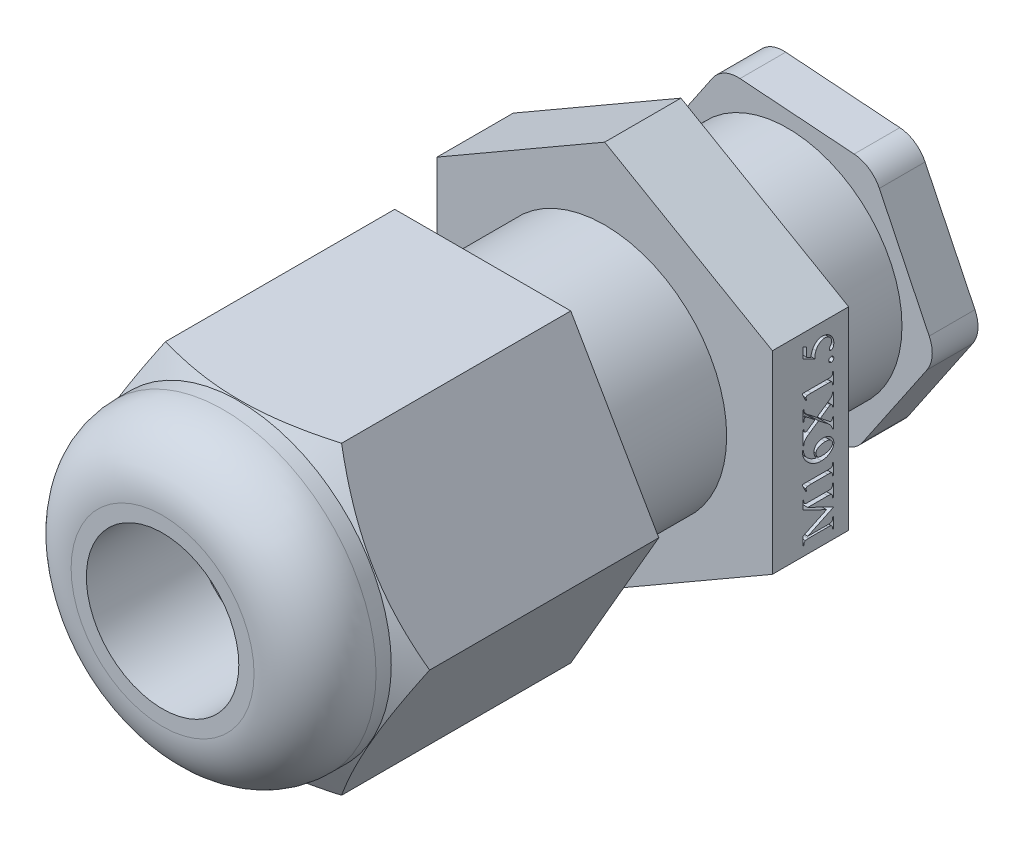
from build123d import *

# Parameters (mm, degrees)
SKETCH16_R          = 7.5
BOSS_EXTRUDE1_DEPTH = 5
BOSS_EXTRUDE2_DEPTH = 4
SKETCH18_R          = 9
BOSS_EXTRUDE3_DEPTH = 1
SKETCH19_R          = 7.5
BOSS_EXTRUDE4_DEPTH = 5
BOSS_EXTRUDE5_DEPTH = 5
SKETCH21_R          = 8
BOSS_EXTRUDE6_DEPTH = 8
BOSS_EXTRUDE7_DEPTH = 16
SKETCH24_R          = 10
BOSS_EXTRUDE8_DEPTH = 5
SKETCH25_R          = 5
CUT_EXTRUDE1_DEPTH  = 12
SKETCH26_R          = 6.75
CUT_EXTRUDE2_DEPTH  = 42
FILLET1_R           = 4
SKETCH29_R          = 19.264757238
SKETCH29_R_2        = 9.872983346
CUT_EXTRUDE6_DEPTH  = 11
CUT_EXTRUDE6_TAPER  = 60
SKETCH30_R          = 18.678262181
SKETCH30_R_2        = 11
CUT_EXTRUDE7_DEPTH  = 10.7366
CUT_EXTRUDE7_TAPER  = 60
CUT_EXTRUDE8_DEPTH  = 1
CUT_EXTRUDE9_DEPTH  = 1
SKETCH_2_OUTSIDE_W  = 39.556
SKETCH_2_OUTSIDE_H  = 39.556
CUT_EXTRUDE_2_DEPTH = 4
CUT_EXTRUDE_START   = -2
SKETCH_3_R          = 18.187553
SKETCH_3_R_2        = 7.5
CUT_EXTRUDE_5_DEPTH = 2
SKETCH_1_R          = 14.197721898
CUT_EXTRUDE_6_DEPTH = 5
FILLET_1_R          = 2


with BuildPart() as part:
    # Sketch16 → Boss-Extrude1 (new body)
    with BuildSketch(Plane.XY):
        Circle(SKETCH16_R)
    extrude(amount=BOSS_EXTRUDE1_DEPTH)

    # Sketch17 → Boss-Extrude2 (add)
    with BuildSketch(Plane.XY.offset(5)):
        Polygon((12.701705922, 0), (6.350852961, 11), (-6.350852961, 11), (-12.701705922, 0), (-6.350852961, -11), (6.350852961, -11), align=None)
    extrude(amount=BOSS_EXTRUDE2_DEPTH)

    # Sketch18 → Boss-Extrude3 (add)
    with BuildSketch(Plane.XY.offset(9)):
        Circle(SKETCH18_R)
    extrude(amount=BOSS_EXTRUDE3_DEPTH)

    # Sketch19 → Boss-Extrude4 (add)
    with BuildSketch(Plane.XY.offset(10)):
        Circle(SKETCH19_R)
    extrude(amount=BOSS_EXTRUDE4_DEPTH)

    # Sketch20 → Boss-Extrude5 (add)
    with BuildSketch(Plane.XY.offset(15)):
        Polygon((0, 12.701705922), (-11, 6.350852961), (-11, -6.350852961), (0, -12.701705922), (11, -6.350852961), (11, 6.350852961), align=None)
    extrude(amount=BOSS_EXTRUDE5_DEPTH)

    # Sketch21 → Boss-Extrude6 (add)
    with BuildSketch(Plane.XY.offset(20)):
        Circle(SKETCH21_R)
    extrude(amount=BOSS_EXTRUDE6_DEPTH)

    # Sketch22 → Boss-Extrude7 (add)
    with BuildSketch(Plane.XY.offset(28)):
        Polygon((-11.547005384, 0), (-5.773502692, -10), (5.773502692, -10), (11.547005384, 0), (5.773502692, 10), (-5.773502692, 10), align=None)
    extrude(amount=BOSS_EXTRUDE7_DEPTH)

    # Sketch24 → Boss-Extrude8 (add)
    with BuildSketch(Plane.XY.offset(44)):
        Circle(SKETCH24_R)
    extrude(amount=BOSS_EXTRUDE8_DEPTH)

    # Sketch25 → Cut-Extrude1 (cut)
    with BuildSketch(Plane.XY.offset(49)):
        Circle(SKETCH25_R)
    extrude(amount=-CUT_EXTRUDE1_DEPTH, mode=Mode.SUBTRACT)

    # Sketch26 → Cut-Extrude2 (cut)
    with BuildSketch(Plane(origin=(0, 0, 0), x_dir=(-1, 0, 0), z_dir=(0, 0, -1))):
        Circle(SKETCH26_R)
    extrude(amount=-CUT_EXTRUDE2_DEPTH, mode=Mode.SUBTRACT)

    # Fillet1
    fillet1_edges = [part.edges().sort_by_distance(p)[0] for p in [
        (-10, 0, 49),
    ]]
    fillet(fillet1_edges, radius=FILLET1_R)

    # Sketch29 → Cut-Extrude6 (cut)
    with BuildSketch(Plane.XY.offset(44)):
        Circle(SKETCH29_R)
        Circle(SKETCH29_R_2, mode=Mode.SUBTRACT)
    extrude(amount=-CUT_EXTRUDE6_DEPTH, taper=CUT_EXTRUDE6_TAPER, mode=Mode.SUBTRACT)

    # Sketch30 → Cut-Extrude7 (cut)
    with BuildSketch(Plane(origin=(0, 0, 5), x_dir=(-1, 0, 0), z_dir=(0, 0, -1))):
        Circle(SKETCH30_R)
        Circle(SKETCH30_R_2, mode=Mode.SUBTRACT)
    extrude(amount=-CUT_EXTRUDE7_DEPTH, taper=CUT_EXTRUDE7_TAPER, mode=Mode.SUBTRACT)

    # Sketch31 → Cut-Extrude8 (cut)
    # profile 1 of 7: a face of its own
    with BuildSketch(Plane(origin=(11, 0, 0), x_dir=(0, 0, -1), z_dir=(1, 0, 0))):
        with BuildLine():
            Line((-16, -4.541666667), (-17.682725694, -5.347222222))
            Line((-17.682725694, -5.347222222), (-16.361111111, -5.347222222))
            add(Edge.make_bspline(
                [(-16.361111111, -5.347222222), (-16.345770499, -5.34724275), (-16.316662808, -5.347281699), (-16.275288939, -5.344796252), (-16.238320865, -5.34210044), (-16.20592414, -5.337623373), (-16.177749353, -5.332872355), (-16.15448325, -5.325793584), (-16.135149531, -5.318436412), (-16.124901452, -5.311379491), (-16.120225694, -5.308159722)],
                knots=[0, 0, 0, 0, 1.48973486, 2.826663046, 4.025252461, 5.088590954, 6.003687083, 6.795186099, 7.45029523, 8, 8, 8, 8], degree=3))
            add(Edge.make_bspline(
                [(-16.120225694, -5.308159722), (-16.110237738, -5.298343436), (-16.08989818, -5.278353471), (-16.069447736, -5.238216396), (-16.057340454, -5.190968976), (-16.056173249, -5.156912059), (-16.055555556, -5.138888889)],
                knots=[0, 0, 0, 0, 0.893460505, 1.819450328, 2.846037184, 4, 4, 4, 4], degree=3))
            Line((-16.055555556, -5.138888889), (-16.055555556, -5.069444444))
            Line((-16.055555556, -5.069444444), (-16, -5.069444444))
            Line((-16, -5.069444444), (-16, -5.763888889))
            Line((-16, -5.763888889), (-16.055555556, -5.763888889))
            Line((-16.055555556, -5.763888889), (-16.055555556, -5.694444444))
            add(Edge.make_bspline(
                [(-16.055555556, -5.694444444), (-16.055773842, -5.684444844), (-16.056196396, -5.665087834), (-16.060335918, -5.637228468), (-16.066081948, -5.611490136), (-16.07502292, -5.588070034), (-16.086129786, -5.566745894), (-16.100157535, -5.54781163), (-16.116990298, -5.531599488), (-16.129518506, -5.52242981), (-16.135850694, -5.517795139)],
                knots=[0, 0, 0, 0, 1.182386838, 2.288838982, 3.326958154, 4.296765023, 5.246416275, 6.164047556, 7.072046332, 8, 8, 8, 8], degree=3))
            add(Edge.make_bspline(
                [(-16.135850694, -5.517795139), (-16.140565512, -5.515208074), (-16.150944778, -5.509512873), (-16.169397862, -5.503210213), (-16.191871892, -5.498295265), (-16.218030848, -5.493424553), (-16.248338101, -5.490012978), (-16.282396489, -5.488237389), (-16.320433771, -5.486143244), (-16.347073827, -5.4861222), (-16.361111111, -5.486111111)],
                knots=[0, 0, 0, 0, 0.561580455, 1.236271222, 2.028879402, 2.966584022, 4.017422664, 5.2149421, 6.532486222, 8, 8, 8, 8], degree=3))
            Line((-16.361111111, -5.486111111), (-17.638888889, -5.486111111))
            add(Edge.make_bspline(
                [(-17.638888889, -5.486111111), (-17.660469624, -5.486316999), (-17.700390107, -5.486697856), (-17.755471718, -5.492540065), (-17.801415826, -5.500474522), (-17.827650995, -5.510636379), (-17.839409722, -5.515190972)],
                knots=[0, 0, 0, 0, 1.269138846, 2.34767893, 3.259421848, 4, 4, 4, 4], degree=3))
            add(Edge.make_bspline(
                [(-17.839409722, -5.515190972), (-17.846655187, -5.518997182), (-17.861560789, -5.526827437), (-17.881422281, -5.543640307), (-17.899526017, -5.564569511), (-17.915992077, -5.590129375), (-17.929168816, -5.622527858), (-17.938310784, -5.662469948), (-17.943742284, -5.710499249), (-17.944198782, -5.745209655), (-17.944444444, -5.763888889)],
                knots=[0, 0, 0, 0, 0.685402419, 1.410031758, 2.167502244, 3.003026701, 3.950322296, 5.087339078, 6.432565839, 8, 8, 8, 8], degree=3))
            Line((-17.944444444, -5.763888889), (-18, -5.763888889))
            Line((-18, -5.763888889), (-18, -5.194010417))
            Line((-18, -5.194010417), (-16.445746528, -4.450954861))
            Line((-16.445746528, -4.450954861), (-18, -3.705729167))
            Line((-18, -3.705729167), (-18, -3.152777778))
            Line((-18, -3.152777778), (-17.944444444, -3.152777778))
            Line((-17.944444444, -3.152777778), (-17.944444444, -3.220920139))
            add(Edge.make_bspline(
                [(-17.944444444, -3.220920139), (-17.944236475, -3.231065833), (-17.943836667, -3.250570269), (-17.939601147, -3.278699435), (-17.933997309, -3.304618532), (-17.924963948, -3.328154692), (-17.91389469, -3.349510102), (-17.899699402, -3.368420291), (-17.883163992, -3.38507985), (-17.870505641, -3.394261169), (-17.864149306, -3.398871528)],
                knots=[0, 0, 0, 0, 1.192663738, 2.292818382, 3.341598875, 4.305885976, 5.250132179, 6.162540657, 7.077327887, 8, 8, 8, 8], degree=3))
            add(Edge.make_bspline(
                [(-17.864149306, -3.398871528), (-17.859434488, -3.401458593), (-17.849055222, -3.407153794), (-17.830602138, -3.413456454), (-17.808128108, -3.418371402), (-17.781969152, -3.423242114), (-17.751661899, -3.426653689), (-17.717603511, -3.428429278), (-17.679566229, -3.430523423), (-17.652926173, -3.430544467), (-17.638888889, -3.430555556)],
                knots=[0, 0, 0, 0, 0.561580455, 1.236271222, 2.028879402, 2.966584022, 4.017422664, 5.2149421, 6.532486222, 8, 8, 8, 8], degree=3))
            Line((-17.638888889, -3.430555556), (-16.361111111, -3.430555556))
            add(Edge.make_bspline(
                [(-16.361111111, -3.430555556), (-16.345770926, -3.430574035), (-16.316664045, -3.430609099), (-16.275284764, -3.428149617), (-16.238334116, -3.425370198), (-16.205855699, -3.421149479), (-16.177817424, -3.415606733), (-16.154375426, -3.408831289), (-16.1351064, -3.400891646), (-16.124897362, -3.393550355), (-16.120225694, -3.390190972)],
                knots=[0, 0, 0, 0, 1.486776415, 2.821049613, 4.017258766, 5.078485589, 5.994452933, 6.784380121, 7.443731031, 8, 8, 8, 8], degree=3))
            add(Edge.make_bspline(
                [(-16.120225694, -3.390190972), (-16.110219938, -3.38038311), (-16.08975233, -3.360320312), (-16.069649851, -3.32001649), (-16.057259884, -3.272885286), (-16.056146959, -3.238952075), (-16.055555556, -3.220920139)],
                knots=[0, 0, 0, 0, 0.893634595, 1.828003868, 2.845812335, 4, 4, 4, 4], degree=3))
            Line((-16.055555556, -3.220920139), (-16.055555556, -3.152777778))
            Line((-16.055555556, -3.152777778), (-16, -3.152777778))
            Line((-16, -3.152777778), (-16, -3.986111111))
            Line((-16, -3.986111111), (-16.055555556, -3.986111111))
            Line((-16.055555556, -3.986111111), (-16.055555556, -3.916666667))
            add(Edge.make_bspline(
                [(-16.055555556, -3.916666667), (-16.0557699, -3.906522909), (-16.056181965, -3.887022195), (-16.060311747, -3.859006777), (-16.066194348, -3.833179556), (-16.074797067, -3.809609778), (-16.086272013, -3.78846108), (-16.100154537, -3.769610817), (-16.116874922, -3.753375639), (-16.129503227, -3.744485755), (-16.135850694, -3.740017361)],
                knots=[0, 0, 0, 0, 1.198333024, 2.303717216, 3.340834392, 4.325725627, 5.259386468, 6.176132048, 7.08325442, 8, 8, 8, 8], degree=3))
            add(Edge.make_bspline(
                [(-16.135850694, -3.740017361), (-16.140565512, -3.737430296), (-16.150944778, -3.731735095), (-16.169397862, -3.725432435), (-16.191871892, -3.720517487), (-16.218030848, -3.715646775), (-16.248338101, -3.7122352), (-16.282396489, -3.710459611), (-16.320433771, -3.708365466), (-16.347073827, -3.708344422), (-16.361111111, -3.708333333)],
                knots=[0, 0, 0, 0, 0.561580455, 1.236271222, 2.028879402, 2.966584022, 4.017422664, 5.2149421, 6.532486222, 8, 8, 8, 8], degree=3))
            Line((-16.361111111, -3.708333333), (-17.682725694, -3.708333333))
            Line((-17.682725694, -3.708333333), (-16, -4.513888889))
            Line((-16, -4.513888889), (-16, -4.541666667))
        make_face()
    # profile 2 of 7: a face of its own
    with BuildSketch(Plane(origin=(11, 0, 0), x_dir=(0, 0, -1), z_dir=(1, 0, 0))):
        with BuildLine():
            Line((-17.805555556, -2.763888889), (-18.027777778, -2.286024306))
            Line((-18.027777778, -2.286024306), (-18.027777778, -2.236111111))
            Line((-18.027777778, -2.236111111), (-16.361111111, -2.236111111))
            add(Edge.make_bspline(
                [(-16.361111111, -2.236111111), (-16.347367835, -2.235938757), (-16.321327775, -2.235612188), (-16.284270781, -2.235571698), (-16.251452241, -2.23387912), (-16.222606371, -2.233061172), (-16.197920299, -2.230487156), (-16.177104857, -2.228863409), (-16.160531866, -2.225560346), (-16.143725181, -2.221927461), (-16.126407109, -2.214104623), (-16.108214002, -2.201589273), (-16.093474614, -2.18436609), (-16.079752236, -2.163169064), (-16.069453964, -2.133767905), (-16.062202686, -2.094479035), (-16.057289884, -2.044091644), (-16.05617045, -2.00666773), (-16.055555556, -1.986111111)],
                knots=[0, 0, 0, 0, 1.357537047, 2.572192221, 3.65900743, 4.603059937, 5.420664606, 6.110251137, 6.662371709, 7.088655706, 7.805391913, 8.522982225, 9.251584797, 10.028600307, 11.005287387, 12.302763454, 13.969141288, 16, 16, 16, 16], degree=3))
            Line((-16.055555556, -1.986111111), (-16, -1.986111111))
            Line((-16, -1.986111111), (-16, -2.736111111))
            Line((-16, -2.736111111), (-16.055555556, -2.736111111))
            add(Edge.make_bspline(
                [(-16.055555556, -2.736111111), (-16.05613842, -2.71511397), (-16.057193658, -2.677099992), (-16.062369785, -2.62637071), (-16.068746243, -2.587504624), (-16.079059079, -2.559495004), (-16.091786803, -2.539478669), (-16.105599364, -2.523623139), (-16.12180143, -2.51123386), (-16.137153717, -2.502739793), (-16.152676082, -2.497548721), (-16.169095794, -2.494992891), (-16.189719584, -2.491693297), (-16.215117285, -2.489846854), (-16.245062851, -2.488105793), (-16.279647056, -2.486722315), (-16.318866657, -2.486587902), (-16.346499217, -2.486276028), (-16.361111111, -2.486111111)],
                knots=[0, 0, 0, 0, 2.071866718, 3.750981977, 5.030543592, 5.947914073, 6.672790165, 7.360438368, 8.011547801, 8.675827944, 9.08214479, 9.619746245, 10.312267781, 11.143377009, 12.130110662, 13.273034934, 14.558000933, 16, 16, 16, 16], degree=3))
            Line((-16.361111111, -2.486111111), (-17.444444444, -2.486111111))
            add(Edge.make_bspline(
                [(-17.444444444, -2.486111111), (-17.460649391, -2.486014188), (-17.491615251, -2.485828978), (-17.53587599, -2.487082399), (-17.575690623, -2.487469683), (-17.610817141, -2.489612993), (-17.641409823, -2.490861849), (-17.66724918, -2.493829345), (-17.688806335, -2.495908033), (-17.701406234, -2.498737038), (-17.70703125, -2.5)],
                knots=[0, 0, 0, 0, 1.476765178, 2.821934835, 4.035278551, 5.104597693, 6.029081604, 6.824151588, 7.47506195, 8, 8, 8, 8], degree=3))
            add(Edge.make_bspline(
                [(-17.70703125, -2.5), (-17.714034764, -2.501841571), (-17.727310236, -2.50533235), (-17.745533876, -2.513223798), (-17.761036495, -2.523287736), (-17.777569957, -2.539247759), (-17.792525305, -2.564415602), (-17.794544394, -2.587013137), (-17.795572917, -2.598524306)],
                knots=[0, 0, 0, 0, 0.903062441, 1.711795068, 2.468214314, 3.196286531, 4.571790261, 6, 6, 6, 6], degree=3))
            add(Edge.make_bspline(
                [(-17.795572917, -2.598524306), (-17.794801971, -2.607964456), (-17.793084312, -2.628997), (-17.784300237, -2.662845199), (-17.769598653, -2.701592158), (-17.756863996, -2.728533915), (-17.75, -2.743055556)],
                knots=[0, 0, 0, 0, 0.743837888, 1.657262055, 2.737261251, 4, 4, 4, 4], degree=3))
            Line((-17.75, -2.743055556), (-17.805555556, -2.763888889))
        make_face()
    # profile 3 of 7: a face of its own
    with BuildSketch(Plane(origin=(11, 0, 0), x_dir=(0, 0, -1), z_dir=(1, 0, 0))):
        with BuildLine():
            Line((-18.027777778, -0.319444444), (-17.972222222, -0.319444444))
            add(Edge.make_bspline(
                [(-17.972222222, -0.319444444), (-17.968745061, -0.349454345), (-17.962073094, -0.407037245), (-17.945703481, -0.488657648), (-17.924527463, -0.561766925), (-17.898273363, -0.627795747), (-17.864358828, -0.688471903), (-17.824641221, -0.747994059), (-17.777063112, -0.806877683), (-17.722953993, -0.864734974), (-17.66351763, -0.920083707), (-17.599624918, -0.970521884), (-17.533053072, -1.01715125), (-17.462057465, -1.058078985), (-17.385981697, -1.094884046), (-17.303827392, -1.128059868), (-17.215058719, -1.158669764), (-17.153027877, -1.175696344), (-17.12109375, -1.184461806)],
                knots=[0, 0, 0, 0, 1.11204756, 2.133793223, 3.060920484, 3.911654629, 4.743669759, 5.61537704, 6.54383481, 7.52755882, 8.530240389, 9.531080642, 10.522620089, 11.520364966, 12.544842705, 13.632012097, 14.780935022, 16, 16, 16, 16], degree=3))
            add(Edge.make_bspline(
                [(-17.12109375, -1.184461806), (-17.133657591, -1.167135303), (-17.158228218, -1.13325052), (-17.189857115, -1.080410783), (-17.216932756, -1.027825202), (-17.239298545, -0.975258099), (-17.256336229, -0.922353538), (-17.268404041, -0.869487829), (-17.276198319, -0.816490999), (-17.27725135, -0.781131599), (-17.277777778, -0.763454861)],
                knots=[0, 0, 0, 0, 1.123331773, 2.196857368, 3.229697486, 4.227207333, 5.192971132, 6.143860852, 7.072085882, 8, 8, 8, 8], degree=3))
            add(Edge.make_bspline(
                [(-17.277777778, -0.763454861), (-17.277301388, -0.746784227), (-17.276363889, -0.713977636), (-17.26818483, -0.665653594), (-17.255223069, -0.619046415), (-17.236858119, -0.574043934), (-17.21317211, -0.530978523), (-17.184697673, -0.489272536), (-17.150806434, -0.449419691), (-17.111819285, -0.411988664), (-17.069139351, -0.377340267), (-17.022999236, -0.346804428), (-16.973693142, -0.321050656), (-16.921369102, -0.300383808), (-16.86640969, -0.283649305), (-16.808412699, -0.272090437), (-16.747430906, -0.264966945), (-16.705749344, -0.26425334), (-16.684461806, -0.263888889)],
                knots=[0, 0, 0, 0, 0.926349197, 1.822987553, 2.716915442, 3.611711575, 4.518861204, 5.444826117, 6.415086364, 7.422034801, 8.445934706, 9.467778553, 10.493225684, 11.532898844, 12.591568671, 13.683280022, 14.8168086, 16, 16, 16, 16], degree=3))
            add(Edge.make_bspline(
                [(-16.684461806, -0.263888889), (-16.663603955, -0.264217548), (-16.622330987, -0.264867889), (-16.561273609, -0.272744174), (-16.501546206, -0.284506443), (-16.442964267, -0.300167849), (-16.386085284, -0.321924805), (-16.330629395, -0.348059083), (-16.276044854, -0.378175069), (-16.241702729, -0.402035498), (-16.224392361, -0.4140625)],
                knots=[0, 0, 0, 0, 1.016578158, 2.011578234, 2.996749356, 3.984342785, 4.964524385, 5.961897944, 6.972681627, 8, 8, 8, 8], degree=3))
            add(Edge.make_bspline(
                [(-16.224392361, -0.4140625), (-16.204335181, -0.429236569), (-16.165086408, -0.458929854), (-16.113792583, -0.510230188), (-16.069806368, -0.564760292), (-16.033889684, -0.623191634), (-16.006531354, -0.685530172), (-15.986226144, -0.751114206), (-15.974403011, -0.82060857), (-15.9729579, -0.868155765), (-15.972222222, -0.892361111)],
                knots=[0, 0, 0, 0, 1.070547348, 2.094894131, 3.081678243, 4.0500961, 5.007721965, 5.97488336, 6.96905275, 8, 8, 8, 8], degree=3))
            add(Edge.make_bspline(
                [(-15.972222222, -0.892361111), (-15.97265986, -0.909016995), (-15.973519087, -0.941717951), (-15.979684891, -0.989834159), (-15.990021975, -1.035943976), (-16.004890429, -1.080154021), (-16.024183701, -1.122332841), (-16.047137071, -1.16290492), (-16.074548385, -1.201279484), (-16.095687339, -1.224730762), (-16.106336806, -1.236545139)],
                knots=[0, 0, 0, 0, 1.054945317, 2.071203223, 3.06725916, 4.043942597, 5.020109906, 6.001126647, 6.992999677, 8, 8, 8, 8], degree=3))
            add(Edge.make_bspline(
                [(-16.106336806, -1.236545139), (-16.128429237, -1.258773211), (-16.172206569, -1.30281932), (-16.245644822, -1.359079469), (-16.323619452, -1.40693814), (-16.406300359, -1.44601254), (-16.493846394, -1.476693955), (-16.586252128, -1.498159932), (-16.683491559, -1.511533812), (-16.749955892, -1.513093443), (-16.783854167, -1.513888889)],
                knots=[0, 0, 0, 0, 0.996887487, 1.97538571, 2.93683217, 3.905260266, 4.881326787, 5.88466394, 6.921131994, 8, 8, 8, 8], degree=3))
            add(Edge.make_bspline(
                [(-16.783854167, -1.513888889), (-16.805853095, -1.513522413), (-16.849612253, -1.512793437), (-16.914957802, -1.507932181), (-16.979455286, -1.499817457), (-17.0431302, -1.48785252), (-17.105883847, -1.473239756), (-17.167910342, -1.455341086), (-17.229077227, -1.434111473), (-17.289298362, -1.409356759), (-17.348183874, -1.381558883), (-17.405702281, -1.351268455), (-17.461234755, -1.317562229), (-17.5154759, -1.281819013), (-17.567779568, -1.242815088), (-17.618620165, -1.201421775), (-17.66712598, -1.156310265), (-17.714141237, -1.10963281), (-17.757920259, -1.061200651), (-17.798694782, -1.013221449), (-17.835825865, -0.96587042), (-17.868823769, -0.918822921), (-17.898503309, -0.872490472), (-17.924181916, -0.82641134), (-17.945980201, -0.780904238), (-17.969229912, -0.721710451), (-17.992448057, -0.649530774), (-18.012443268, -0.56461954), (-18.025486076, -0.482753878), (-18.027026113, -0.42900947), (-18.027777778, -0.402777778)],
                knots=[0, 0, 0, 0, 1.006519091, 2.00211706, 2.996415824, 3.979256571, 4.965124328, 5.943496579, 6.931606334, 7.926081361, 8.921040949, 9.910081525, 10.898878399, 11.892118928, 12.881093046, 13.88292124, 14.890158396, 15.910556394, 16.913324523, 17.876166787, 18.79114971, 19.665330668, 20.504552116, 21.307593167, 22.077426548, 22.811271048, 24.215940873, 25.542181098, 26.800382202, 28, 28, 28, 28], degree=3))
            Line((-18.027777778, -0.402777778), (-18.027777778, -0.319444444))
        make_face()
        with BuildLine():
            add(Edge.make_bspline(
                [(-17.013888889, -1.208333333), (-16.982370042, -1.21255698), (-16.922740749, -1.220547535), (-16.837787399, -1.229257253), (-16.76251841, -1.234894059), (-16.715430485, -1.235725315), (-16.693576389, -1.236111111)],
                knots=[0, 0, 0, 0, 1.186006894, 2.243760764, 3.18490739, 4, 4, 4, 4], degree=3))
            add(Edge.make_bspline(
                [(-16.693576389, -1.236111111), (-16.66952927, -1.23553416), (-16.620241603, -1.234351624), (-16.544985604, -1.224079082), (-16.466653833, -1.208493511), (-16.387084981, -1.186760108), (-16.309728205, -1.159733161), (-16.23919119, -1.125384622), (-16.177068636, -1.084663663), (-16.141812272, -1.052001569), (-16.124565972, -1.036024306)],
                knots=[0, 0, 0, 0, 0.935169282, 1.916749931, 2.94995263, 4.040933046, 5.12340098, 6.132811626, 7.086630455, 8, 8, 8, 8], degree=3))
            add(Edge.make_bspline(
                [(-16.124565972, -1.036024306), (-16.113835281, -1.023707605), (-16.092733835, -0.999487337), (-16.071606459, -0.955991233), (-16.05781546, -0.909268041), (-16.056320499, -0.876550152), (-16.055555556, -0.859809028)],
                knots=[0, 0, 0, 0, 1.006861896, 1.979951003, 2.966379127, 4, 4, 4, 4], degree=3))
            add(Edge.make_bspline(
                [(-16.055555556, -0.859809028), (-16.055867734, -0.849659172), (-16.056492535, -0.829345019), (-16.062217818, -0.799364936), (-16.072170487, -0.77040995), (-16.084844011, -0.741886327), (-16.102931935, -0.715176572), (-16.12312591, -0.688167184), (-16.148199738, -0.662884135), (-16.176272052, -0.638116658), (-16.207630235, -0.615032404), (-16.242954144, -0.595569584), (-16.281018936, -0.578461517), (-16.3227707, -0.565290865), (-16.367356352, -0.554193309), (-16.415490134, -0.547267104), (-16.466612144, -0.542102751), (-16.501866094, -0.541814601), (-16.519965278, -0.541666667)],
                knots=[0, 0, 0, 0, 0.779158178, 1.559425028, 2.332536961, 3.128085406, 3.94801914, 4.803769406, 5.7154175, 6.676136198, 7.678622712, 8.698633232, 9.768284987, 10.878777097, 12.056618743, 13.293527951, 14.610512161, 16, 16, 16, 16], degree=3))
            add(Edge.make_bspline(
                [(-16.519965278, -0.541666667), (-16.540520347, -0.541831714), (-16.581110359, -0.542157631), (-16.640770158, -0.547277967), (-16.698451294, -0.554522647), (-16.754056182, -0.564739338), (-16.807421341, -0.578864034), (-16.858939127, -0.595301663), (-16.908330392, -0.614692462), (-16.954901827, -0.637147835), (-16.998009544, -0.661753686), (-17.035371913, -0.690168745), (-17.067491535, -0.720459771), (-17.093621648, -0.753678649), (-17.114176564, -0.789266139), (-17.1287529, -0.8276374), (-17.137012932, -0.868571731), (-17.13825435, -0.896664806), (-17.138888889, -0.911024306)],
                knots=[0, 0, 0, 0, 1.236325581, 2.441367134, 3.599860823, 4.733462644, 5.839765943, 6.918852512, 7.985686968, 9.029074807, 10.027827683, 10.966187413, 11.846555316, 12.677192625, 13.499901681, 14.309848309, 15.13609552, 16, 16, 16, 16], degree=3))
            add(Edge.make_bspline(
                [(-17.138888889, -0.911024306), (-17.137500925, -0.929641298), (-17.134564207, -0.969032006), (-17.119418794, -1.019173564), (-17.099214086, -1.063983293), (-17.076916913, -1.105720818), (-17.048111179, -1.154947401), (-17.025890773, -1.189610688), (-17.013888889, -1.208333333)],
                knots=[0, 0, 0, 0, 1.025998358, 2.17085558, 2.859346783, 3.732571271, 4.775296047, 6, 6, 6, 6], degree=3))
        make_face(mode=Mode.SUBTRACT)
    # profile 4 of 7: a face of its own
    with BuildSketch(Plane(origin=(11, 0, 0), x_dir=(0, 0, -1), z_dir=(1, 0, 0))):
        with BuildLine():
            Line((-17.084635417, 1.111545139), (-16.464409722, 1.541666667))
            add(Edge.make_bspline(
                [(-16.464409722, 1.541666667), (-16.443369718, 1.555900414), (-16.40324454, 1.583045449), (-16.346757654, 1.62330771), (-16.295858347, 1.659808134), (-16.251406046, 1.694288324), (-16.213069349, 1.725875995), (-16.180094854, 1.753797039), (-16.153868464, 1.779627076), (-16.126465983, 1.810009128), (-16.099915643, 1.849840187), (-16.076974469, 1.902330807), (-16.060788936, 1.960198004), (-16.057337329, 2.001048003), (-16.055555556, 2.022135417)],
                knots=[0, 0, 0, 0, 1.387499065, 2.64608532, 3.78894435, 4.808511917, 5.718178103, 6.502496184, 7.167495823, 7.727304262, 8.735538158, 9.765011329, 10.846263605, 12, 12, 12, 12], degree=3))
            Line((-16.055555556, 2.022135417), (-16, 2.022135417))
            Line((-16, 2.022135417), (-16, 1.170572917))
            Line((-16, 1.170572917), (-16.055555556, 1.170572917))
            add(Edge.make_bspline(
                [(-16.055555556, 1.170572917), (-16.055982993, 1.183892516), (-16.056778999, 1.20869724), (-16.060078368, 1.243095374), (-16.065311622, 1.272000034), (-16.071143943, 1.288823558), (-16.073784722, 1.296440972)],
                knots=[0, 0, 0, 0, 1.251101252, 2.329891665, 3.243802496, 4, 4, 4, 4], degree=3))
            add(Edge.make_bspline(
                [(-16.073784722, 1.296440972), (-16.078833933, 1.306319873), (-16.088977845, 1.326166674), (-16.114602901, 1.347014241), (-16.141679442, 1.363978837), (-16.162103583, 1.365855588), (-16.171875, 1.366753472)],
                knots=[0, 0, 0, 0, 1.037879564, 2.085109583, 3.083868751, 4, 4, 4, 4], degree=3))
            add(Edge.make_bspline(
                [(-16.171875, 1.366753472), (-16.183546136, 1.366101273), (-16.20730091, 1.364773824), (-16.229849414, 1.357167709), (-16.241319444, 1.353298611)],
                knots=[0, 0, 0, 0, 0.98263495, 2, 2, 2, 2], degree=3))
            add(Edge.make_bspline(
                [(-16.241319444, 1.353298611), (-16.247446187, 1.35050122), (-16.263489336, 1.343176126), (-16.291281753, 1.325948713), (-16.329624183, 1.302118163), (-16.358396344, 1.283478661), (-16.374565972, 1.273003472)],
                knots=[0, 0, 0, 0, 0.51870283, 1.358246357, 2.515364433, 4, 4, 4, 4], degree=3))
            Line((-16.374565972, 1.273003472), (-16.858940972, 0.937065972))
            Line((-16.858940972, 0.937065972), (-16.324652778, 0.5234375))
            add(Edge.make_bspline(
                [(-16.324652778, 0.5234375), (-16.312552032, 0.513533798), (-16.290552475, 0.495528541), (-16.2605638, 0.472415306), (-16.237405589, 0.455314472), (-16.215504495, 0.441885932), (-16.190776405, 0.433226561), (-16.171508432, 0.431734318), (-16.161892361, 0.430989583)],
                knots=[0, 0, 0, 0, 1.473107506, 2.678158142, 3.56707412, 4.184223009, 5.093799796, 6, 6, 6, 6], degree=3))
            add(Edge.make_bspline(
                [(-16.161892361, 0.430989583), (-16.154728485, 0.431480889), (-16.140719423, 0.432441644), (-16.120916174, 0.440396506), (-16.103080885, 0.452846391), (-16.0873151, 0.471189961), (-16.074013759, 0.496662172), (-16.064619816, 0.530587697), (-16.058530073, 0.573162442), (-16.056606846, 0.604433903), (-16.055555556, 0.621527778)],
                knots=[0, 0, 0, 0, 0.706616658, 1.38179906, 2.080689712, 2.841480654, 3.75083194, 4.901116067, 6.306061405, 8, 8, 8, 8], degree=3))
            Line((-16.055555556, 0.621527778), (-16, 0.621527778))
            Line((-16, 0.621527778), (-16, -0.086371528))
            Line((-16, -0.086371528), (-16.055555556, -0.086371528))
            add(Edge.make_bspline(
                [(-16.055555556, -0.086371528), (-16.056994986, -0.074340026), (-16.059783102, -0.051035522), (-16.066355132, -0.017377502), (-16.074654488, 0.013845348), (-16.082558635, 0.033198788), (-16.086371528, 0.042534722)],
                knots=[0, 0, 0, 0, 1.092521585, 2.116167512, 3.09125531, 4, 4, 4, 4], degree=3))
            add(Edge.make_bspline(
                [(-16.086371528, 0.042534722), (-16.092958122, 0.057537768), (-16.106235315, 0.087780764), (-16.130215524, 0.131594778), (-16.157841591, 0.17410923), (-16.188639737, 0.216953465), (-16.226154622, 0.260140586), (-16.270998196, 0.305902596), (-16.325109915, 0.35374667), (-16.364604379, 0.385856795), (-16.385416667, 0.402777778)],
                knots=[0, 0, 0, 0, 0.829792481, 1.67268776, 2.526568635, 3.397362151, 4.343374619, 5.421396993, 6.641160757, 8, 8, 8, 8], degree=3))
            Line((-16.385416667, 0.402777778), (-16.973524306, 0.858072917))
            Line((-16.973524306, 0.858072917), (-17.555989583, 0.458333333))
            add(Edge.make_bspline(
                [(-17.555989583, 0.458333333), (-17.574871516, 0.445417514), (-17.611357245, 0.420460162), (-17.662817234, 0.382743262), (-17.709501139, 0.3468309), (-17.750842294, 0.311994276), (-17.787281678, 0.278778181), (-17.818632957, 0.247107573), (-17.845073844, 0.217203727), (-17.872748151, 0.178990168), (-17.900290612, 0.130063128), (-17.924450007, 0.067546014), (-17.939928433, 0.000716429), (-17.942921191, -0.045491507), (-17.944444444, -0.069010417)],
                knots=[0, 0, 0, 0, 1.201407909, 2.321491269, 3.35044647, 4.294144544, 5.159992148, 5.939075303, 6.63385896, 7.253953056, 8.414142417, 9.57121737, 10.763798548, 12, 12, 12, 12], degree=3))
            Line((-17.944444444, -0.069010417), (-18, -0.069010417))
            Line((-18, -0.069010417), (-18, 0.848524306))
            Line((-18, 0.848524306), (-17.944444444, 0.848524306))
            add(Edge.make_bspline(
                [(-17.944444444, 0.848524306), (-17.943396144, 0.830539241), (-17.941465251, 0.797412082), (-17.933223374, 0.752438031), (-17.922323479, 0.71587864), (-17.906027755, 0.688300329), (-17.886544189, 0.669476348), (-17.867196844, 0.655313727), (-17.846350258, 0.646407899), (-17.831820937, 0.645441874), (-17.824652778, 0.644965278)],
                knots=[0, 0, 0, 0, 1.65453305, 3.047527545, 4.195711958, 5.14457816, 5.953356552, 6.669203758, 7.343440861, 8, 8, 8, 8], degree=3))
            add(Edge.make_bspline(
                [(-17.824652778, 0.644965278), (-17.813846648, 0.645963346), (-17.789402095, 0.648221077), (-17.750722729, 0.6636635), (-17.704973596, 0.684973108), (-17.673691842, 0.70460433), (-17.656684028, 0.715277778)],
                knots=[0, 0, 0, 0, 0.704815569, 1.594363781, 2.692061453, 4, 4, 4, 4], degree=3))
            Line((-17.656684028, 0.715277778), (-17.198784722, 1.032552083))
            Line((-17.198784722, 1.032552083), (-17.650173611, 1.381944444))
            add(Edge.make_bspline(
                [(-17.650173611, 1.381944444), (-17.66286544, 1.39125762), (-17.686039976, 1.408262931), (-17.717709739, 1.430386396), (-17.743118095, 1.446239084), (-17.767522216, 1.459807219), (-17.794995472, 1.469233076), (-17.816621758, 1.470654937), (-17.827256944, 1.471354167)],
                knots=[0, 0, 0, 0, 1.403888287, 2.563417624, 3.444161552, 4.073323755, 5.052515946, 6, 6, 6, 6], degree=3))
            add(Edge.make_bspline(
                [(-17.827256944, 1.471354167), (-17.837616918, 1.470669563), (-17.858068165, 1.469318111), (-17.87579945, 1.459056466), (-17.884548611, 1.453993056)],
                knots=[0, 0, 0, 0, 1.013138557, 2, 2, 2, 2], degree=3))
            add(Edge.make_bspline(
                [(-17.884548611, 1.453993056), (-17.894227442, 1.446143921), (-17.913173105, 1.430779764), (-17.929401302, 1.402653531), (-17.936296968, 1.374106106), (-17.940345628, 1.343719858), (-17.943176044, 1.304443731), (-17.943994929, 1.275179017), (-17.944444444, 1.259114583)],
                knots=[0, 0, 0, 0, 1.047759031, 2.050918148, 2.671197225, 3.524264695, 4.64098155, 6, 6, 6, 6], degree=3))
            Line((-17.944444444, 1.259114583), (-18, 1.259114583))
            Line((-18, 1.259114583), (-18, 1.981336806))
            Line((-18, 1.981336806), (-17.944444444, 1.981336806))
            add(Edge.make_bspline(
                [(-17.944444444, 1.981336806), (-17.943501359, 1.968000847), (-17.9417104, 1.942675286), (-17.935793171, 1.906612813), (-17.92868278, 1.874083359), (-17.920821062, 1.854377435), (-17.917100694, 1.845052083)],
                knots=[0, 0, 0, 0, 1.147917493, 2.179944869, 3.138703006, 4, 4, 4, 4], degree=3))
            add(Edge.make_bspline(
                [(-17.917100694, 1.845052083), (-17.910920059, 1.832081649), (-17.89860031, 1.80622792), (-17.876701769, 1.76894672), (-17.851409109, 1.733653495), (-17.828145751, 1.704668369), (-17.806178581, 1.681959657), (-17.787020606, 1.662619822), (-17.76451793, 1.641807641), (-17.738196433, 1.62003612), (-17.709866988, 1.595466895), (-17.677753947, 1.569906403), (-17.642949896, 1.542149183), (-17.61824628, 1.52352298), (-17.60546875, 1.513888889)],
                knots=[0, 0, 0, 0, 1.123530187, 2.239512141, 3.376131121, 4.517921176, 5.142280629, 5.846454719, 6.647292451, 7.5384269, 8.517942262, 9.580127646, 10.748361669, 12, 12, 12, 12], degree=3))
            Line((-17.60546875, 1.513888889), (-17.084635417, 1.111545139))
        make_face()
    # profile 5 of 7: a face of its own
    with BuildSketch(Plane(origin=(11, 0, 0), x_dir=(0, 0, -1), z_dir=(1, 0, 0))):
        with BuildLine():
            Line((-17.805555556, 2.402777778), (-18.027777778, 2.880642361))
            Line((-18.027777778, 2.880642361), (-18.027777778, 2.930555556))
            Line((-18.027777778, 2.930555556), (-16.361111111, 2.930555556))
            add(Edge.make_bspline(
                [(-16.361111111, 2.930555556), (-16.347367835, 2.93072791), (-16.321327775, 2.931054479), (-16.284270781, 2.931094969), (-16.251452241, 2.932787547), (-16.222606371, 2.933605495), (-16.197920299, 2.936179511), (-16.177104857, 2.937803258), (-16.160531866, 2.941106321), (-16.143725181, 2.944739206), (-16.126407109, 2.952562044), (-16.108214002, 2.965077394), (-16.093474614, 2.982300576), (-16.079752236, 3.003497603), (-16.069453964, 3.032898762), (-16.062202686, 3.072187632), (-16.057289884, 3.122575023), (-16.05617045, 3.159998937), (-16.055555556, 3.180555556)],
                knots=[0, 0, 0, 0, 1.357537047, 2.572192221, 3.65900743, 4.603059937, 5.420664606, 6.110251137, 6.662371709, 7.088655706, 7.805391913, 8.522982225, 9.251584797, 10.028600307, 11.005287387, 12.302763454, 13.969141288, 16, 16, 16, 16], degree=3))
            Line((-16.055555556, 3.180555556), (-16, 3.180555556))
            Line((-16, 3.180555556), (-16, 2.430555556))
            Line((-16, 2.430555556), (-16.055555556, 2.430555556))
            add(Edge.make_bspline(
                [(-16.055555556, 2.430555556), (-16.05613842, 2.451552696), (-16.057193658, 2.489566675), (-16.062369785, 2.540295957), (-16.068746243, 2.579162043), (-16.079059079, 2.607171662), (-16.091786803, 2.627187997), (-16.105599364, 2.643043528), (-16.12180143, 2.655432806), (-16.137153717, 2.663926874), (-16.152676082, 2.669117946), (-16.169095794, 2.671673775), (-16.189719584, 2.67497337), (-16.215117285, 2.676819812), (-16.245062851, 2.678560874), (-16.279647056, 2.679944352), (-16.318866657, 2.680078765), (-16.346499217, 2.680390639), (-16.361111111, 2.680555556)],
                knots=[0, 0, 0, 0, 2.071866718, 3.750981977, 5.030543592, 5.947914073, 6.672790165, 7.360438368, 8.011547801, 8.675827944, 9.08214479, 9.619746245, 10.312267781, 11.143377009, 12.130110662, 13.273034934, 14.558000933, 16, 16, 16, 16], degree=3))
            Line((-16.361111111, 2.680555556), (-17.444444444, 2.680555556))
            add(Edge.make_bspline(
                [(-17.444444444, 2.680555556), (-17.460649391, 2.680652479), (-17.491615251, 2.680837689), (-17.53587599, 2.679584268), (-17.575690623, 2.679196984), (-17.610817141, 2.677053673), (-17.641409823, 2.675804818), (-17.66724918, 2.672837322), (-17.688806335, 2.670758633), (-17.701406234, 2.667929629), (-17.70703125, 2.666666667)],
                knots=[0, 0, 0, 0, 1.476765178, 2.821934835, 4.035278551, 5.104597693, 6.029081604, 6.824151588, 7.47506195, 8, 8, 8, 8], degree=3))
            add(Edge.make_bspline(
                [(-17.70703125, 2.666666667), (-17.714034764, 2.664825096), (-17.727310236, 2.661334316), (-17.745533876, 2.653442868), (-17.761036495, 2.643378931), (-17.777569957, 2.627418907), (-17.792525305, 2.602251065), (-17.794544394, 2.57965353), (-17.795572917, 2.568142361)],
                knots=[0, 0, 0, 0, 0.903062441, 1.711795068, 2.468214314, 3.196286531, 4.571790261, 6, 6, 6, 6], degree=3))
            add(Edge.make_bspline(
                [(-17.795572917, 2.568142361), (-17.794801971, 2.558702211), (-17.793084312, 2.537669667), (-17.784300237, 2.503821468), (-17.769598653, 2.465074508), (-17.756863996, 2.438132752), (-17.75, 2.423611111)],
                knots=[0, 0, 0, 0, 0.743837888, 1.657262055, 2.737261251, 4, 4, 4, 4], degree=3))
            Line((-17.75, 2.423611111), (-17.805555556, 2.402777778))
        make_face()
    # profile 6 of 7: a face of its own
    with BuildSketch(Plane(origin=(11, 0, 0), x_dir=(0, 0, -1), z_dir=(1, 0, 0))):
        with BuildLine():
            add(Edge.make_bspline(
                [(-16.305555556, 3.930555556), (-16.30500339, 3.941906114), (-16.303922422, 3.964126985), (-16.294475638, 3.99592628), (-16.279039247, 4.024827574), (-16.257439121, 4.049681109), (-16.232388855, 4.07126631), (-16.20316105, 4.085757021), (-16.171938717, 4.095708866), (-16.1501104, 4.096708388), (-16.138888889, 4.097222222)],
                knots=[0, 0, 0, 0, 1.036574804, 2.029291735, 3.006444391, 4.011439207, 5.026580925, 6.009275979, 6.976607756, 8, 8, 8, 8], degree=3))
            add(Edge.make_bspline(
                [(-16.138888889, 4.097222222), (-16.127682628, 4.096680552), (-16.105883974, 4.095626884), (-16.074438908, 4.086063544), (-16.046030544, 4.070058304), (-16.020535463, 4.048908981), (-15.999386141, 4.023413901), (-15.983380901, 3.995005536), (-15.97381756, 3.96356047), (-15.972763892, 3.941761817), (-15.972222222, 3.930555556)],
                knots=[0, 0, 0, 0, 1.026121023, 1.9960321, 2.982151502, 4, 5.017848498, 6.0039679, 6.973878977, 8, 8, 8, 8], degree=3))
            add(Edge.make_bspline(
                [(-15.972222222, 3.930555556), (-15.972757306, 3.919345562), (-15.973798162, 3.897539648), (-15.983491721, 3.866024604), (-15.999237106, 3.837318123), (-16.02057189, 3.811812846), (-16.045900909, 3.790530336), (-16.074570173, 3.775142867), (-16.105866909, 3.765453468), (-16.127676834, 3.764420115), (-16.138888889, 3.763888889)],
                knots=[0, 0, 0, 0, 1.025445604, 1.994718261, 2.991811449, 4.008989973, 5.026168498, 6.005281739, 6.974554396, 8, 8, 8, 8], degree=3))
            add(Edge.make_bspline(
                [(-16.138888889, 3.763888889), (-16.150237227, 3.764443495), (-16.172453752, 3.765529242), (-16.204284423, 3.774941526), (-16.233166448, 3.790560156), (-16.258466987, 3.81170413), (-16.279538074, 3.83722951), (-16.294116924, 3.866259822), (-16.304035152, 3.897511979), (-16.305039328, 3.919336168), (-16.305555556, 3.930555556)],
                knots=[0, 0, 0, 0, 1.03634917, 2.028850014, 3.005789971, 4.02071072, 5.027228157, 6.009709305, 6.976830521, 8, 8, 8, 8], degree=3))
        make_face()
    # profile 7 of 7: a face of its own
    with BuildSketch(Plane(origin=(11, 0, 0), x_dir=(0, 0, -1), z_dir=(1, 0, 0))):
        with BuildLine():
            Line((-18, 5.569444444), (-17.75, 5.453993056))
            Line((-17.75, 5.453993056), (-17.75, 4.850694444))
            Line((-17.75, 4.850694444), (-17.477430556, 4.716579861))
            add(Edge.make_bspline(
                [(-17.477430556, 4.716579861), (-17.472267286, 4.750811344), (-17.462182332, 4.817672651), (-17.439426215, 4.913932537), (-17.411736881, 5.003962551), (-17.37855633, 5.087470618), (-17.339188504, 5.164329652), (-17.294881915, 5.234848092), (-17.245559111, 5.299530845), (-17.207623499, 5.337209065), (-17.188802083, 5.355902778)],
                knots=[0, 0, 0, 0, 1.161098856, 2.267870976, 3.314957367, 4.319094488, 5.278631444, 6.207879786, 7.110855526, 8, 8, 8, 8], degree=3))
            add(Edge.make_bspline(
                [(-17.188802083, 5.355902778), (-17.172137609, 5.370694878), (-17.139249228, 5.399888011), (-17.085892854, 5.437580943), (-17.03064399, 5.470192054), (-16.972688038, 5.495981034), (-16.912825236, 5.516866868), (-16.850624299, 5.530835705), (-16.786291642, 5.53992705), (-16.742653135, 5.541080665), (-16.720486111, 5.541666667)],
                knots=[0, 0, 0, 0, 1.034913379, 2.042466206, 3.030809393, 4.011898082, 4.985794297, 5.972603802, 6.970144889, 8, 8, 8, 8], degree=3))
            add(Edge.make_bspline(
                [(-16.720486111, 5.541666667), (-16.694838347, 5.540893368), (-16.644159792, 5.539365373), (-16.569744861, 5.527920934), (-16.498241205, 5.508762873), (-16.430478059, 5.481620024), (-16.366625897, 5.449174655), (-16.307096514, 5.412636483), (-16.252695132, 5.371697432), (-16.203223705, 5.326900777), (-16.158448048, 5.279068094), (-16.118219044, 5.228522374), (-16.082990835, 5.175077133), (-16.062944001, 5.137603063), (-16.052951389, 5.118923611)],
                knots=[0, 0, 0, 0, 1.109973118, 2.193245106, 3.250644398, 4.307821095, 5.346960253, 6.348091328, 7.327616489, 8.289850039, 9.233644659, 10.16089877, 11.083275353, 12, 12, 12, 12], degree=3))
            add(Edge.make_bspline(
                [(-16.052951389, 5.118923611), (-16.040640631, 5.091961885), (-16.016365355, 5.038796728), (-15.990562987, 4.955707565), (-15.975484953, 4.871357289), (-15.973308681, 4.814728897), (-15.972222222, 4.786458333)],
                knots=[0, 0, 0, 0, 1.02997589, 2.030983818, 3.017009033, 4, 4, 4, 4], degree=3))
            add(Edge.make_bspline(
                [(-15.972222222, 4.786458333), (-15.972310766, 4.772559994), (-15.972480713, 4.74588404), (-15.97595376, 4.707259361), (-15.979798399, 4.671518502), (-15.986364621, 4.638559067), (-15.995024657, 4.608875613), (-16.00505897, 4.581765324), (-16.016912209, 4.557594868), (-16.035284468, 4.530508393), (-16.059716467, 4.502522743), (-16.091943631, 4.477291296), (-16.126334179, 4.461035169), (-16.150446651, 4.459225113), (-16.162326389, 4.458333333)],
                knots=[0, 0, 0, 0, 1.193809471, 2.291353365, 3.330739885, 4.281667572, 5.174842429, 5.985362969, 6.763780473, 7.48101505, 8.793310572, 9.937197352, 10.983697965, 12, 12, 12, 12], degree=3))
            add(Edge.make_bspline(
                [(-16.162326389, 4.458333333), (-16.168880988, 4.458775466), (-16.18184469, 4.459649916), (-16.200654078, 4.46595978), (-16.217777689, 4.476904182), (-16.233775266, 4.491003963), (-16.247194408, 4.50866546), (-16.256617258, 4.529000313), (-16.263283122, 4.5512348), (-16.263681778, 4.566931829), (-16.263888889, 4.575086806)],
                knots=[0, 0, 0, 0, 0.916128209, 1.811920583, 2.738491236, 3.74165137, 4.781681047, 5.813410906, 6.864015437, 8, 8, 8, 8], degree=3))
            add(Edge.make_bspline(
                [(-16.263888889, 4.575086806), (-16.263289935, 4.586841157), (-16.262163735, 4.608942587), (-16.255116208, 4.636703852), (-16.243352441, 4.658591192), (-16.231414823, 4.680450509), (-16.214188519, 4.706698522), (-16.201137152, 4.725722833), (-16.194010417, 4.736111111)],
                knots=[0, 0, 0, 0, 1.183562772, 2.225425144, 2.843910142, 3.678152315, 4.732148587, 6, 6, 6, 6], degree=3))
            add(Edge.make_bspline(
                [(-16.194010417, 4.736111111), (-16.18258003, 4.753363569), (-16.160343453, 4.786926353), (-16.135094412, 4.840115928), (-16.117747816, 4.893715402), (-16.113303836, 4.930008918), (-16.111111111, 4.947916667)],
                knots=[0, 0, 0, 0, 1.077967054, 2.097067893, 3.06106564, 4, 4, 4, 4], degree=3))
            add(Edge.make_bspline(
                [(-16.111111111, 4.947916667), (-16.111556984, 4.961249417), (-16.112443633, 4.987762485), (-16.118652781, 5.026760016), (-16.128680218, 5.064634145), (-16.14305584, 5.101209589), (-16.161898531, 5.136460313), (-16.184771665, 5.170454774), (-16.211102274, 5.203644868), (-16.242028733, 5.234477949), (-16.275136237, 5.263283794), (-16.310838601, 5.288311704), (-16.348130377, 5.309646468), (-16.387398559, 5.327068515), (-16.428396302, 5.340629691), (-16.471318092, 5.349996317), (-16.515862664, 5.356464413), (-16.546272794, 5.356956383), (-16.561631944, 5.357204861)],
                knots=[0, 0, 0, 0, 0.947842643, 1.884848592, 2.800663295, 3.729102607, 4.672524552, 5.636915223, 6.639454037, 7.679708613, 8.737517211, 9.756442826, 10.774693088, 11.787889967, 12.80614023, 13.839402362, 14.908753564, 16, 16, 16, 16], degree=3))
            add(Edge.make_bspline(
                [(-16.561631944, 5.357204861), (-16.576692165, 5.356869122), (-16.606613867, 5.356202073), (-16.651215959, 5.350889611), (-16.694895217, 5.341779258), (-16.737820984, 5.329026042), (-16.780015686, 5.31287001), (-16.821609907, 5.293475748), (-16.862323473, 5.270149003), (-16.901956862, 5.243490294), (-16.939908448, 5.213368427), (-16.976679593, 5.181476421), (-17.010652826, 5.146170049), (-17.041629955, 5.107669551), (-17.071526701, 5.067288445), (-17.09874106, 5.023887411), (-17.12359747, 4.977732345), (-17.138070118, 4.945550758), (-17.145399306, 4.929253472)],
                knots=[0, 0, 0, 0, 0.942339042, 1.872242621, 2.806280494, 3.731632735, 4.671619954, 5.631584808, 6.600771111, 7.60526339, 8.617762632, 9.631354347, 10.649505543, 11.678987005, 12.722114532, 13.792242015, 14.881954957, 16, 16, 16, 16], degree=3))
            add(Edge.make_bspline(
                [(-17.145399306, 4.929253472), (-17.150784296, 4.915571843), (-17.161835712, 4.887493545), (-17.175507895, 4.842739012), (-17.188263214, 4.79476106), (-17.198481195, 4.742820493), (-17.207074512, 4.687500256), (-17.214006227, 4.628577431), (-17.219220499, 4.566184979), (-17.221204461, 4.52330122), (-17.222222222, 4.501302083)],
                knots=[0, 0, 0, 0, 0.807230533, 1.656649213, 2.568235188, 3.532821807, 4.562222431, 5.642410622, 6.790569369, 8, 8, 8, 8], degree=3))
            Line((-17.222222222, 4.501302083), (-18, 4.873697917))
            Line((-18, 4.873697917), (-18, 5.569444444))
        make_face()
    extrude(amount=-CUT_EXTRUDE8_DEPTH, mode=Mode.SUBTRACT)

    # Sketch32 → Cut-Extrude9 (cut)
    with BuildSketch(Plane.ZY.offset(11)):
        with BuildLine():
            Line((17.235376603, 0.717948718), (17.120392628, 0.224358974))
            add(Edge.make_bspline(
                [(17.120392628, 0.224358974), (17.074129833, 0.236724775), (16.983634063, 0.260913817), (16.854124599, 0.30873849), (16.732585491, 0.36241582), (16.619336895, 0.423248263), (16.51502992, 0.491901623), (16.418324021, 0.566556865), (16.33124721, 0.650170977), (16.251789802, 0.739676058), (16.18170858, 0.835769002), (16.121192159, 0.937291258), (16.069704969, 1.043752088), (16.027365065, 1.155581775), (15.995500658, 1.272852818), (15.972276011, 1.394961388), (15.957970981, 1.522263544), (15.956087682, 1.609037058), (15.955128205, 1.653245192)],
                knots=[0, 0, 0, 0, 1.145254194, 2.240259345, 3.299159039, 4.322497661, 5.312016644, 6.284080175, 7.241264552, 8.196044782, 9.144516039, 10.082428046, 11.020306713, 11.970622414, 12.939253955, 13.924100776, 14.94240044, 16, 16, 16, 16], degree=3))
            add(Edge.make_bspline(
                [(15.955128205, 1.653245192), (15.955787181, 1.698603594), (15.957076415, 1.787343682), (15.967562703, 1.917342795), (15.985749538, 2.040984717), (16.011017542, 2.158038549), (16.042259858, 2.268898281), (16.08156546, 2.373104207), (16.128650743, 2.470473807), (16.182198879, 2.561819274), (16.243031973, 2.646752631), (16.309508305, 2.727205293), (16.383457894, 2.801224136), (16.463134724, 2.870659913), (16.549589841, 2.934000286), (16.641648716, 2.993575561), (16.740933423, 3.046477904), (16.845603222, 3.094667835), (16.95464472, 3.136965167), (17.065904046, 3.174383511), (17.179602897, 3.204975053), (17.294784517, 3.231312396), (17.41241808, 3.2504452), (17.531620974, 3.265636054), (17.653124015, 3.273988291), (17.734797473, 3.275087357), (17.775941506, 3.275641026)],
                knots=[0, 0, 0, 0, 1.180702053, 2.309949215, 3.392367133, 4.431746864, 5.425408375, 6.388154007, 7.326956194, 8.237882283, 9.141054626, 10.043899035, 10.951650021, 11.86168169, 12.792564695, 13.739356664, 14.713891418, 15.718426911, 16.737522708, 17.757217648, 18.772674716, 19.801476837, 20.831699174, 21.873853055, 22.928926693, 24, 24, 24, 24], degree=3))
            add(Edge.make_bspline(
                [(17.775941506, 3.275641026), (17.820358149, 3.274849163), (17.908114217, 3.273284643), (18.037600844, 3.264452951), (18.162571277, 3.248232332), (18.283107728, 3.225706617), (18.399307784, 3.197202552), (18.511228169, 3.162017568), (18.618725276, 3.120596359), (18.721919123, 3.073066649), (18.819652404, 3.019107383), (18.912083616, 2.960348005), (18.997624401, 2.895317467), (19.078295751, 2.826086087), (19.151651675, 2.750073762), (19.219399874, 2.669018), (19.281076569, 2.582794724), (19.336473436, 2.49154575), (19.385098135, 2.396407763), (19.428208527, 2.298960069), (19.463984644, 2.198825337), (19.493453434, 2.096253126), (19.516673547, 1.991378483), (19.532626871, 1.884067504), (19.542768888, 1.77450069), (19.544165752, 1.700476378), (19.544871795, 1.663060897)],
                knots=[0, 0, 0, 0, 1.185707875, 2.342659285, 3.462327534, 4.547613321, 5.614308126, 6.6541031, 7.677087892, 8.687498172, 9.684258347, 10.65506769, 11.608299702, 12.550216682, 13.489899864, 14.424433375, 15.367919117, 16.316916113, 17.271127473, 18.218092331, 19.159347997, 20.107093383, 21.065232435, 22.024264667, 23.00136746, 24, 24, 24, 24], degree=3))
            add(Edge.make_bspline(
                [(19.544871795, 1.663060897), (19.544088877, 1.621195914), (19.542549975, 1.538906144), (19.529679848, 1.417952122), (19.508603857, 1.30225128), (19.480258764, 1.19128062), (19.44183066, 1.086050923), (19.396547256, 0.984985545), (19.34152112, 0.889785481), (19.278999232, 0.799638381), (19.208965764, 0.715762388), (19.132040579, 0.637836829), (19.047922896, 0.567416905), (18.957174751, 0.502995691), (18.860155559, 0.444755638), (18.75545056, 0.394439119), (18.64449572, 0.349821218), (18.567002612, 0.326153749), (18.527544071, 0.314102564)],
                knots=[0, 0, 0, 0, 1.098272147, 2.15876265, 3.187156245, 4.182191634, 5.159804027, 6.123040409, 7.08444023, 8.040446874, 8.998320048, 9.947933246, 10.909743667, 11.87280436, 12.865569703, 13.874826233, 14.91788753, 16, 16, 16, 16], degree=3))
            Line((18.527544071, 0.314102564), (18.421674679, 0.807692308))
            add(Edge.make_bspline(
                [(18.421674679, 0.807692308), (18.451948722, 0.817384225), (18.51120439, 0.836354305), (18.595638598, 0.870062166), (18.674078859, 0.906375277), (18.745616992, 0.946494367), (18.811309007, 0.989167397), (18.870530522, 1.035536684), (18.923144533, 1.085467258), (18.970050779, 1.138196044), (19.009983032, 1.195020849), (19.045617066, 1.254729475), (19.074537027, 1.318737301), (19.099524228, 1.385577535), (19.118347338, 1.456026206), (19.13162644, 1.529894721), (19.139302898, 1.607275939), (19.140443773, 1.660005807), (19.141025641, 1.686899038)],
                knots=[0, 0, 0, 0, 1.235448321, 2.418154634, 3.531842193, 4.593464837, 5.60397568, 6.574568355, 7.512901199, 8.420602914, 9.313080425, 10.209065825, 11.119673064, 12.039525284, 12.980625235, 13.950111628, 14.954518094, 16, 16, 16, 16], degree=3))
            add(Edge.make_bspline(
                [(19.141025641, 1.686899038), (19.140577868, 1.717775132), (19.139697231, 1.778499295), (19.130051348, 1.867708767), (19.115858927, 1.953387096), (19.094522081, 2.0348671), (19.068173369, 2.112495358), (19.034728693, 2.185659983), (18.996245951, 2.255581199), (18.951225105, 2.321207427), (18.901748247, 2.382610614), (18.847920563, 2.43948947), (18.789535127, 2.490949242), (18.728091095, 2.539211437), (18.66145006, 2.581125573), (18.591500227, 2.619009335), (18.517318438, 2.652390166), (18.412931652, 2.688797816), (18.278477468, 2.725912977), (18.11395188, 2.75811327), (17.94683347, 2.778623405), (17.834426703, 2.78090624), (17.778044872, 2.782051282)],
                knots=[0, 0, 0, 0, 0.935340829, 1.839539385, 2.716332021, 3.564952244, 4.389223442, 5.197547524, 5.999672926, 6.805106076, 7.605948402, 8.387484373, 9.17506262, 9.962736403, 10.752572556, 11.557507294, 12.372290778, 13.214621762, 14.905525332, 16.594588543, 18.291888101, 20, 20, 20, 20], degree=3))
            add(Edge.make_bspline(
                [(17.778044872, 2.782051282), (17.707169479, 2.780649333), (17.569692278, 2.77792997), (17.370152258, 2.754715774), (17.184509907, 2.715555281), (17.039359151, 2.670381295), (16.932381846, 2.624708993), (16.857457189, 2.587811889), (16.788127279, 2.545684639), (16.723996065, 2.499387119), (16.665251212, 2.448319858), (16.611580508, 2.393195125), (16.562467555, 2.334000397), (16.52021141, 2.270034328), (16.482691638, 2.203759037), (16.44932834, 2.136010869), (16.421111139, 2.066747167), (16.399191445, 1.995688484), (16.380249781, 1.923832671), (16.367876198, 1.850388312), (16.360892937, 1.775376351), (16.359619013, 1.725007673), (16.358974359, 1.699519231)],
                knots=[0, 0, 0, 0, 2.106800676, 4.086567274, 5.961803297, 7.741774319, 8.594863961, 9.418348957, 10.222732955, 11.003851254, 11.767339612, 12.533888942, 13.289239296, 14.050479348, 14.809782439, 15.552498685, 16.294434424, 17.03062117, 17.762037579, 18.502279399, 19.242097133, 20, 20, 20, 20], degree=3))
            add(Edge.make_bspline(
                [(16.358974359, 1.699519231), (16.359612211, 1.66910223), (16.360872194, 1.609017899), (16.371902663, 1.520927239), (16.388153416, 1.436006768), (16.413244996, 1.355295942), (16.443915158, 1.277670046), (16.482017874, 1.203733637), (16.527156919, 1.133380909), (16.578880921, 1.066611138), (16.638120262, 1.004899179), (16.703628102, 0.94794086), (16.775414223, 0.895705743), (16.854345905, 0.849301802), (16.94040905, 0.809130396), (17.032377883, 0.772250401), (17.131340375, 0.741421031), (17.200199695, 0.725885217), (17.235376603, 0.717948718)],
                knots=[0, 0, 0, 0, 1.013280452, 2.001587178, 2.954741544, 3.891007537, 4.813763809, 5.733392028, 6.65811846, 7.596035232, 8.543572245, 9.504144266, 10.485644879, 11.498176693, 12.550315313, 13.648080895, 14.798517897, 16, 16, 16, 16], degree=3))
        make_face()
        with BuildLine():
            Line((18.019230769, -2.019230769), (17.615384615, -2.019230769))
            Line((17.615384615, -2.019230769), (17.615384615, -0.717948718))
            add(Edge.make_bspline(
                [(17.615384615, -0.717948718), (17.568114308, -0.72079288), (17.475596306, -0.726359506), (17.341179758, -0.745638017), (17.214089338, -0.772042635), (17.0948014, -0.806781501), (16.983221391, -0.850637222), (16.879108693, -0.9021168), (16.783348131, -0.963230343), (16.694838246, -1.030489307), (16.616609781, -1.105933167), (16.547129161, -1.185592649), (16.489543127, -1.271444785), (16.440917332, -1.361451223), (16.404936867, -1.457677687), (16.377780098, -1.558279357), (16.362418242, -1.664461306), (16.360138503, -1.736865225), (16.358974359, -1.773838141)],
                knots=[0, 0, 0, 0, 1.240561562, 2.428041681, 3.5547557, 4.640025402, 5.679537167, 6.692957414, 7.678455202, 8.652332706, 9.601002629, 10.521721563, 11.416930282, 12.304628216, 13.196373426, 14.102576421, 15.031084445, 16, 16, 16, 16], degree=3))
            add(Edge.make_bspline(
                [(16.358974359, -1.773838141), (16.35968231, -1.806579786), (16.361066099, -1.870577914), (16.370874033, -1.96440206), (16.387778497, -2.053435486), (16.410580318, -2.138097909), (16.44120094, -2.217673877), (16.477375416, -2.293131301), (16.521188132, -2.363398372), (16.571378812, -2.429161804), (16.628002612, -2.49022875), (16.692207447, -2.545855814), (16.761859712, -2.597906768), (16.839222452, -2.644146934), (16.922589039, -2.686206918), (17.012827856, -2.723420646), (17.109701387, -2.75556779), (17.177073939, -2.773088525), (17.211538462, -2.782051282)],
                knots=[0, 0, 0, 0, 1.086946731, 2.124589587, 3.127418088, 4.0930578, 5.031154065, 5.954209283, 6.86713244, 7.77496374, 8.697268625, 9.626434275, 10.591668669, 11.580349977, 12.614389492, 13.689306315, 14.817961445, 16, 16, 16, 16], degree=3))
            Line((17.211538462, -2.782051282), (17.121794872, -3.275641026))
            add(Edge.make_bspline(
                [(17.121794872, -3.275641026), (17.074623906, -3.262722892), (16.982162539, -3.237401632), (16.849900319, -3.189510606), (16.726287842, -3.13549045), (16.612004898, -3.074718623), (16.50669068, -3.006969019), (16.410463036, -2.932894003), (16.323580601, -2.851482836), (16.245419344, -2.76403736), (16.17736151, -2.669152197), (16.116971694, -2.568765007), (16.067562157, -2.460507356), (16.025753969, -2.346277578), (15.994806265, -2.22493982), (15.971211252, -2.097594423), (15.958224476, -1.963409706), (15.956174551, -1.871787106), (15.955128205, -1.825020032)],
                knots=[0, 0, 0, 0, 1.15433917, 2.262658291, 3.317621757, 4.33712592, 5.315156248, 6.27095571, 7.200087102, 8.122509402, 9.035292716, 9.953215045, 10.883918019, 11.840433943, 12.821448257, 13.836642866, 14.895754077, 16, 16, 16, 16], degree=3))
            add(Edge.make_bspline(
                [(15.955128205, -1.825020032), (15.955529277, -1.791357301), (15.956321, -1.724906474), (15.962674358, -1.626862999), (15.973413437, -1.532187413), (15.986904532, -1.440519532), (16.006331628, -1.352493454), (16.028137221, -1.267213986), (16.05612746, -1.185859327), (16.08654912, -1.107178399), (16.121740988, -1.032021558), (16.161012957, -0.960314576), (16.204742029, -0.892026733), (16.252394548, -0.82703809), (16.303586857, -0.764703017), (16.360120648, -0.706659081), (16.420190884, -0.651301774), (16.505581049, -0.582174458), (16.618838754, -0.504054377), (16.763538686, -0.423957249), (16.915453516, -0.35631036), (17.075214598, -0.302110121), (17.242878143, -0.262262901), (17.417853102, -0.236219152), (17.600405271, -0.221204202), (17.72450036, -0.223292656), (17.787860577, -0.224358974)],
                knots=[0, 0, 0, 0, 0.874971321, 1.727208899, 2.552363421, 3.351388022, 4.134198335, 4.894528636, 5.637974781, 6.368981519, 7.086459597, 7.793340797, 8.492690183, 9.192567061, 9.887150989, 10.587449575, 11.29685829, 12.009381421, 13.441711948, 14.866667569, 16.302600673, 17.758771584, 19.245477716, 20.775634034, 22.353709812, 24, 24, 24, 24], degree=3))
            add(Edge.make_bspline(
                [(17.787860577, -0.224358974), (17.826905328, -0.224883307), (17.904151806, -0.225920652), (18.018813515, -0.234636042), (18.130923654, -0.248496891), (18.240465221, -0.268140755), (18.347217999, -0.29335301), (18.45134601, -0.324366604), (18.552987452, -0.360736431), (18.651847326, -0.402743351), (18.747527884, -0.450472371), (18.839129699, -0.504013292), (18.92576199, -0.564460743), (19.008890341, -0.629224391), (19.086784277, -0.701568432), (19.161185393, -0.77876896), (19.229986699, -0.863264882), (19.295133368, -0.952183445), (19.353950702, -1.046729421), (19.405706613, -1.14586238), (19.447958739, -1.250177796), (19.48426508, -1.358150361), (19.511338149, -1.47105835), (19.531104127, -1.588157074), (19.542150675, -1.709824215), (19.543955611, -1.792280111), (19.544871795, -1.834134615)],
                knots=[0, 0, 0, 0, 1.050776463, 2.078865327, 3.093140971, 4.090104199, 5.072675865, 6.043906669, 7.01287379, 7.976764106, 8.933216234, 9.889047625, 10.829521955, 11.774591925, 12.72283847, 13.688287418, 14.657989286, 15.653224588, 16.6533776, 17.652125193, 18.659059783, 19.679499874, 20.715410224, 21.780548252, 22.873409214, 24, 24, 24, 24], degree=3))
            add(Edge.make_bspline(
                [(19.544871795, -1.834134615), (19.54407265, -1.878331904), (19.542504799, -1.965043066), (19.529930757, -2.092380677), (19.507833157, -2.21384593), (19.478964402, -2.330207934), (19.439799575, -2.440670862), (19.393404666, -2.546259361), (19.336351633, -2.645293545), (19.273162669, -2.739451119), (19.201224886, -2.826248022), (19.123179893, -2.906735477), (19.038144757, -2.979920492), (18.945995385, -3.045168268), (18.847294885, -3.102766347), (18.742268935, -3.153336315), (18.630638525, -3.197371957), (18.552533151, -3.219512091), (18.512820513, -3.230769231)],
                knots=[0, 0, 0, 0, 1.126179675, 2.209464643, 3.25619809, 4.270211655, 5.260959454, 6.239368691, 7.204859382, 8.169541515, 9.125785253, 10.073403181, 11.023637604, 11.980437567, 12.946717785, 13.932278809, 14.94866818, 16, 16, 16, 16], degree=3))
            Line((18.512820513, -3.230769231), (18.378205128, -2.737179487))
            add(Edge.make_bspline(
                [(18.378205128, -2.737179487), (18.409208091, -2.729027621), (18.469754304, -2.713107703), (18.555992649, -2.681441311), (18.637116799, -2.647793661), (18.711663095, -2.608101846), (18.780359856, -2.564777308), (18.843545573, -2.517555874), (18.900407135, -2.465683453), (18.951104827, -2.409132463), (18.996324478, -2.348814635), (19.034857258, -2.283747323), (19.068138559, -2.214926989), (19.094534217, -2.141493175), (19.115853283, -2.064204288), (19.130179157, -1.982259343), (19.139680453, -1.896292036), (19.140572077, -1.837433151), (19.141025641, -1.807491987)],
                knots=[0, 0, 0, 0, 1.169959561, 2.284833953, 3.351667598, 4.374798962, 5.364494572, 6.315227826, 7.251564263, 8.170112712, 9.085006339, 9.999780542, 10.927363788, 11.872333804, 12.845404671, 13.85148654, 14.907064034, 16, 16, 16, 16], degree=3))
            add(Edge.make_bspline(
                [(19.141025641, -1.807491987), (19.140063096, -1.7672547), (19.138182292, -1.688631373), (19.124089785, -1.573811468), (19.100413581, -1.46581137), (19.067448986, -1.364370879), (19.024288477, -1.270045092), (18.972476878, -1.181698102), (18.910245452, -1.100768414), (18.839072561, -1.026869498), (18.759759648, -0.960644035), (18.673953287, -0.901109997), (18.580802818, -0.850838894), (18.481368475, -0.80782901), (18.375342431, -0.772752167), (18.262430126, -0.746400497), (18.143159023, -0.727227973), (18.061129483, -0.721085927), (18.019230769, -0.717948718)],
                knots=[0, 0, 0, 0, 1.100528544, 2.150423677, 3.158675127, 4.121005708, 5.062273264, 5.990950969, 6.916719386, 7.848143721, 8.79194807, 9.738908457, 10.700176652, 11.682349454, 12.699259046, 13.750613029, 14.851067294, 16, 16, 16, 16], degree=3))
            Line((18.019230769, -0.717948718), (18.019230769, -2.019230769))
        make_face()
    extrude(amount=-CUT_EXTRUDE9_DEPTH, mode=Mode.SUBTRACT)

    # Эскиз2 outside → Вырез-Вытянуть2 (cut)
    with BuildSketch(Plane(origin=(0, 0, 5), x_dir=(-1, 0, 0), z_dir=(0, 0, -1))):
        Rectangle(SKETCH_2_OUTSIDE_W, SKETCH_2_OUTSIDE_H)
        Polygon((4.277610758, 8.833763611), (-5.51145832, 8.121401389), (-9.789069077, -0.712362222), (-4.277610758, -8.833763611), (5.51145832, -8.121401389), (9.789069077, 0.712362222), align=None, mode=Mode.SUBTRACT)
    extrude(amount=-CUT_EXTRUDE_2_DEPTH, mode=Mode.SUBTRACT)

    # Эскиз3 → Вырез-Вытянуть5 (cut)
    with BuildSketch(Plane.XY.offset(10).offset(CUT_EXTRUDE_START)):
        Circle(SKETCH_3_R)
        Circle(SKETCH_3_R_2, mode=Mode.SUBTRACT)
    extrude(amount=CUT_EXTRUDE_5_DEPTH, mode=Mode.SUBTRACT)

    # Эскиз1 → Вырез-Вытянуть6 (cut)
    with BuildSketch(Plane(origin=(0, 0, 0), x_dir=(-1, 0, 0), z_dir=(0, 0, -1))):
        Circle(SKETCH_1_R)
    extrude(amount=-CUT_EXTRUDE_6_DEPTH, mode=Mode.SUBTRACT)

    # Скругление1
    fillet_1_edges = [part.edges().sort_by_distance(p)[0] for p in [
        (9.789069077, -0.712362222, 6.5),
        (4.277610758, -8.833763611, 6.5),
        (-5.51145832, -8.121401389, 6.5),
        (-9.789069077, 0.712362222, 6.5),
        (-4.277610758, 8.833763611, 6.5),
        (5.51145832, 8.121401389, 6.5),
    ]]
    fillet(fillet_1_edges, radius=FILLET_1_R)


solid = part.part
